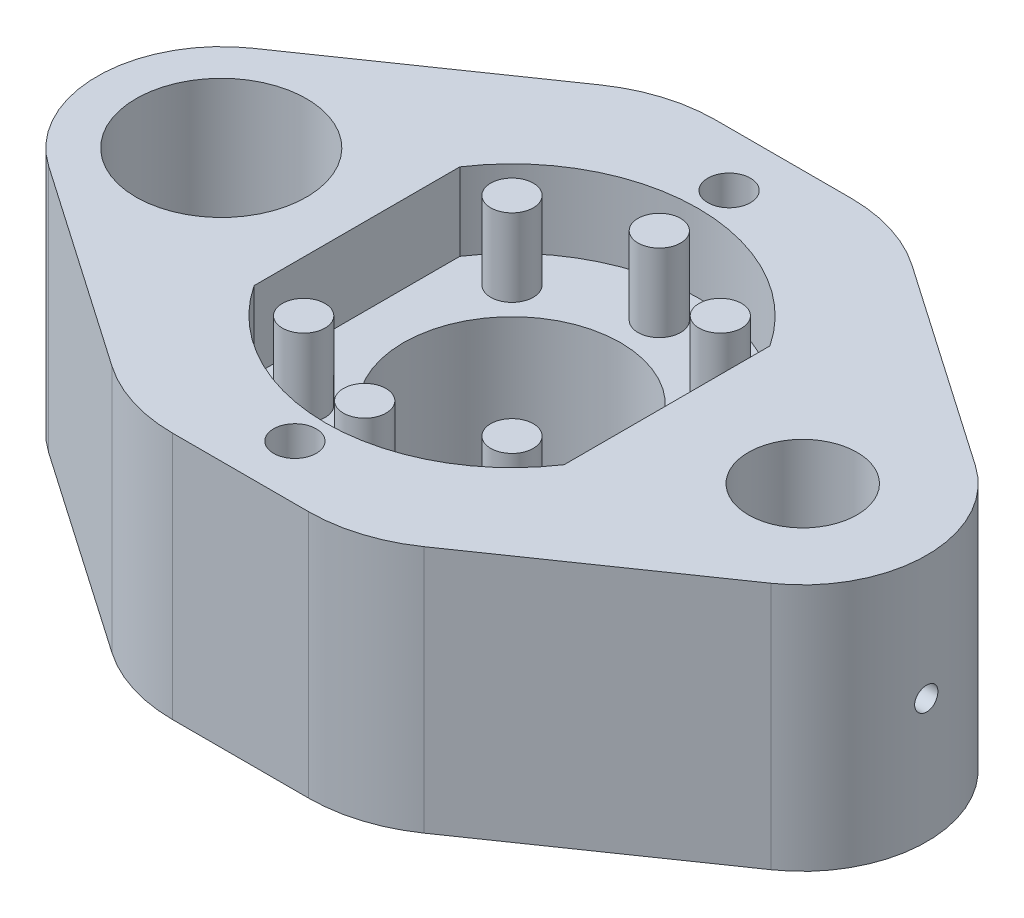
from build123d import *

# Parameters (mm, degrees)
SKETCH1_R               = 11
SKETCH1_R_2             = 7
EXTRUDE2_DEPTH          = 32
SKETCH_R                = 14
EXTRUDE3_DEPTH          = 22
FILLET1_R               = 20
SKETCH5_R               = 2.75
EXTRUDE5_DEPTH          = 10
CIRPATTERN1_COUNT       = 3
CIRPATTERN1_ANGLE       = 90
MIRROR1_COPY_1_SKETCH_R = 2.75
MIRROR1_COPY_1_DEPTH    = 10
MIRROR1_COPY_2_SKETCH_R = 2.75
MIRROR1_COPY_2_DEPTH    = 10
EXTRUDE10_START         = 14.5
EXTRUDE10_OUTLINE_R     = 8
EXTRUDE10_OUTLINE_R_2   = 7
EXTRUDE10_DEPTH         = 3
EXTRUDE11_START         = 45.358117006
EXTRUDE11_OUTLINE_R     = 1.5
EXTRUDE11_DEPTH         = 8.141882994
M5_CLEARANCE_HOLE1_D    = 5.5


# Read off the part's stored shape, not the designer's step: Extrude10, Extrude11
with BuildPart() as part:
    # Sketch1 → Extrude2 (new body)
    with BuildSketch(Plane(origin=(0, 0, 0), x_dir=(1, 0, 0), z_dir=(0, 1, 0))):
        with BuildLine():
            Line((-15, -35), (15, -35))
            Line((15, -35), (46.596913018, -13.162301226))
            ThreePointArc((46.596913018, -13.162301226), (53.5, 0), (46.596913018, 13.162301226))
            Line((46.596913018, 13.162301226), (15, 35))
            Line((15, 35), (-15, 35))
            Line((-15, 35), (-46.596913018, 13.162301226))
            ThreePointArc((-46.596913018, 13.162301226), (-53.5, 0), (-46.596913018, -13.162301226))
            Line((-46.596913018, -13.162301226), (-15, -35))
        make_face()
        with Locations(Location((-37.5, 0, 0), (0, 0, 270))):
            Circle(SKETCH1_R, mode=Mode.SUBTRACT)
        with Locations(Location((37.5, 0, 0), (0, 0, 270))):
            Circle(SKETCH1_R_2, mode=Mode.SUBTRACT)
        with BuildLine():
            Line((-20, 13.266499161), (-20, -13.266499161))
            ThreePointArc((-20, -13.266499161), (0, -24), (20, -13.266499161))
            Line((20, -13.266499161), (20, 13.266499161))
            ThreePointArc((20, 13.266499161), (0, 24), (-20, 13.266499161))
        make_face(mode=Mode.SUBTRACT)
    extrude(amount=EXTRUDE2_DEPTH)

    # Sketch → Extrude3 (add)
    with BuildSketch(Plane(origin=(0, 0, 0), x_dir=(1, 0, 0), z_dir=(0, 1, 0))):
        with BuildLine():
            Line((20, 13.266499161), (20, -13.266499161))
            ThreePointArc((20, -13.266499161), (0, -24), (-20, -13.266499161))
            Line((-20, -13.266499161), (-20, 13.266499161))
            ThreePointArc((-20, 13.266499161), (0, 24), (20, 13.266499161))
        make_face()
        with Locations(Location((0, 0, 0), (0, 0, 90))):
            Circle(SKETCH_R, mode=Mode.SUBTRACT)
    extrude(amount=EXTRUDE3_DEPTH)

    # Fillet1
    fillet1_edges = [part.edges().sort_by_distance(p)[0] for p in [
        (15, 16, 35),
        (-15, 16, 35),
        (-15, 16, -35),
        (15, 16, -35),
    ]]
    fillet(fillet1_edges, radius=FILLET1_R)

    # Sketch5 → Extrude5 (add)
    with BuildSketch(Plane(origin=(0, 22, 0), x_dir=(1, 0, 0), z_dir=(0, 1, 0))):
        with Locations(Location((13.435028843, 13.435028843, 0), (0, 0, 90))):
            Circle(SKETCH5_R)
    extrude5 = extrude(amount=EXTRUDE5_DEPTH)

    # CirPattern1: Extrude5 ×3 about axis
    cirpattern1_axis = Axis((0, 0, 0), (0, 1, 0))
    for i in range(1, CIRPATTERN1_COUNT):
        add(extrude5.rotate(cirpattern1_axis, i * CIRPATTERN1_ANGLE / (CIRPATTERN1_COUNT - 1)))

    # Mirror1: Extrude5 across plane
    add(extrude5.mirror(Plane.XY))

    # Mirror1 copy 1 sketch → Mirror1 copy 1 (add)
    with BuildSketch(Plane(origin=(0, 22, 0), x_dir=(0.7071067811865467, 0, 0.7071067811865483), z_dir=(0, 1, 0))):
        with Locations((13.435028843, -13.435028843)):
            Circle(MIRROR1_COPY_1_SKETCH_R)
    extrude(amount=MIRROR1_COPY_1_DEPTH)

    # Mirror1 copy 2 sketch → Mirror1 copy 2 (add)
    with BuildSketch(Plane.ZX.offset(22)):
        with Locations((13.435028843, -13.435028843)):
            Circle(MIRROR1_COPY_2_SKETCH_R)
    extrude(amount=MIRROR1_COPY_2_DEPTH)

    # Extrude10 outline → Extrude10 (cut)
    with BuildSketch(Plane(origin=(0, 0, 0), x_dir=(1, 0, 0), z_dir=(0, 1, 0)).offset(EXTRUDE10_START)):
        with Locations((37.5, 0)):
            Circle(EXTRUDE10_OUTLINE_R)
        with Locations((37.5, 0)):
            Circle(EXTRUDE10_OUTLINE_R_2, mode=Mode.SUBTRACT)
    extrude(amount=EXTRUDE10_DEPTH, mode=Mode.SUBTRACT)

    # Extrude11 outline → Extrude11 (cut)
    with BuildSketch(Plane.YZ.offset(EXTRUDE11_START)):
        with Locations((16, 0)):
            Circle(EXTRUDE11_OUTLINE_R)
    extrude(amount=EXTRUDE11_DEPTH, mode=Mode.SUBTRACT)

    # M5 Clearance Hole1 (through all)
    with Locations(Plane(origin=(0, 32, 0), x_dir=(1, 0, 0), z_dir=(0, 1, 0))):
        with Locations((0, 28), (0, -28)):
            Hole(M5_CLEARANCE_HOLE1_D / 2)


solid = part.part
